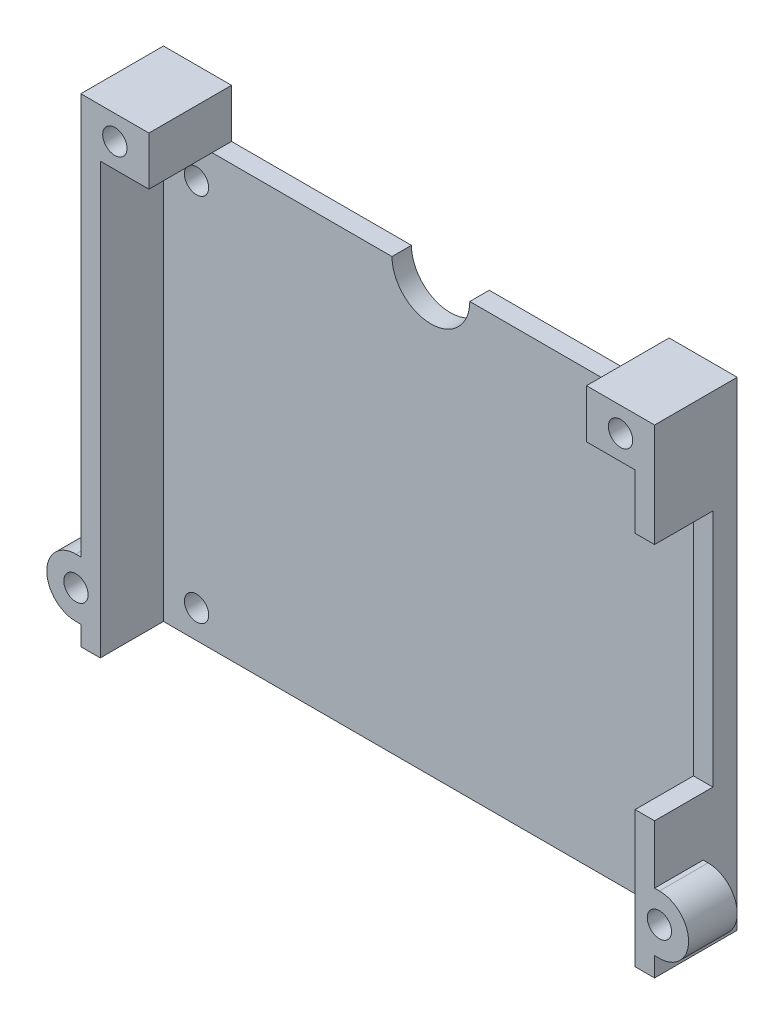
from build123d import *

# Parameters (mm, degrees)
BOSS_EXTRUDE1_DEPTH = 44.25
SKETCH2_W           = 6
SKETCH2_H           = 24.6
CUT_EXTRUDE1_DEPTH  = 10
BOSS_EXTRUDE2_DEPTH = 8.5
CUT_EXTRUDE2_DEPTH  = 11
SKETCH4_W           = 7
SKETCH4_H           = 8.5
BOSS_EXTRUDE3_DEPTH = 5
SKETCH5_R           = 1.25
CUT_EXTRUDE3_DEPTH  = 81.025386597
SKETCH7_R           = 1.25
CUT_EXTRUDE4_DEPTH  = 10
SKETCH8_R           = 4
CUT_EXTRUDE5_DEPTH  = 81.025386597
CUT_EXTRUDE6_DEPTH  = 3.5
BOSS_EXTRUDE4_DEPTH = 3


with BuildPart() as part:
    # Sketch1 → Boss-Extrude1 (new body)
    with BuildSketch(Plane(origin=(0, 0, 0), x_dir=(1, 0, 0), z_dir=(0, 1, 0))):
        Polygon((0, 0), (2, 0), (2, 6.5), (57, 6.5), (57, 0), (59, 0), (59, 8.5), (0, 8.5), align=None)
    extrude(amount=BOSS_EXTRUDE1_DEPTH)

    # Sketch2 → Cut-Extrude1 (cut)
    with BuildSketch(Plane(origin=(59, 0, 0), x_dir=(0, 0, -1), z_dir=(1, 0, 0))):
        with Locations((3, 26.3)):
            Rectangle(SKETCH2_W, SKETCH2_H)
    extrude(amount=-CUT_EXTRUDE1_DEPTH, mode=Mode.SUBTRACT)

    # Sketch3 → Boss-Extrude2 (add)
    with BuildSketch(Plane(origin=(0, 0, -8.5), x_dir=(-1, 0, 0), z_dir=(0, 0, -1))):
        with BuildLine():
            Line((-59, 6.145643924), (-59, 8))
            Line((-59, 8), (-59.5, 8))
            ThreePointArc((-59.5, 8), (-62.5, 5), (-59.5, 2))
            Line((-59.5, 2), (-59, 2))
            Line((-59, 2), (-59, 3.854356076))
            ThreePointArc((-59, 3.854356076), (-60.75, 5), (-59, 6.145643924))
        make_face()
        with BuildLine():
            Line((0.5, 8), (0, 8))
            Line((0, 8), (0, 6.145643924))
            ThreePointArc((0, 6.145643924), (1.75, 5), (0, 3.854356076))
            Line((0, 3.854356076), (0, 2))
            Line((0, 2), (0.5, 2))
            ThreePointArc((0.5, 2), (3.5, 5), (0.5, 8))
        make_face()
    extrude(amount=-BOSS_EXTRUDE2_DEPTH)

    # Sketch3<3> → Cut-Extrude2 (cut)
    with BuildSketch(Plane(origin=(0, 0, -8.5), x_dir=(-1, 0, 0), z_dir=(0, 0, -1))):
        with BuildLine():
            ThreePointArc((-59, 3.854356076), (-58.25, 5), (-59, 6.145643924))
            Line((-59, 6.145643924), (-59, 3.854356076))
        make_face()
        with BuildLine():
            Line((0, 3.854356076), (0, 6.145643924))
            ThreePointArc((0, 6.145643924), (-0.75, 5), (0, 3.854356076))
        make_face()
    extrude(amount=-CUT_EXTRUDE2_DEPTH, mode=Mode.SUBTRACT)

    # Sketch4 → Boss-Extrude3 (add)
    with BuildSketch(Plane(origin=(0, 44.25, 0), x_dir=(1, 0, 0), z_dir=(0, 1, 0))):
        with Locations((3.5, 4.25)):
            Rectangle(SKETCH4_W, SKETCH4_H)
        with Locations((55.5, 4.25)):
            Rectangle(SKETCH4_W, SKETCH4_H)
    extrude(amount=BOSS_EXTRUDE3_DEPTH)

    # Sketch5 → Cut-Extrude3 (cut, through all)
    with BuildSketch(Plane(origin=(0, 0, -8.5), x_dir=(-1, 0, 0), z_dir=(0, 0, -1))):
        with Locations((-55.5, 46.75)):
            Circle(SKETCH5_R)
        with Locations((-3.5, 46.75)):
            Circle(SKETCH5_R)
    extrude(amount=-CUT_EXTRUDE3_DEPTH, mode=Mode.SUBTRACT)

    # Sketch7 → Cut-Extrude4 (cut)
    with BuildSketch(Plane(origin=(0, 0, -8.5), x_dir=(-1, 0, 0), z_dir=(0, 0, -1))):
        with Locations((-5.4, 2.9)):
            Circle(SKETCH7_R)
        with Locations((-53.6, 2.9)):
            Circle(SKETCH7_R)
        with Locations((-53.6, 40.95)):
            Circle(SKETCH7_R)
        with Locations((-5.4, 40.95)):
            Circle(SKETCH7_R)
    extrude(amount=-CUT_EXTRUDE4_DEPTH, mode=Mode.SUBTRACT)

    # Sketch8 → Cut-Extrude5 (cut, through all)
    with BuildSketch(Plane(origin=(0, 0, -8.5), x_dir=(-1, 0, 0), z_dir=(0, 0, -1))):
        with Locations((-29.5, 44.25)):
            Circle(SKETCH8_R)
    extrude(amount=-CUT_EXTRUDE5_DEPTH, mode=Mode.SUBTRACT)

    # Sketch3<4> → Cut-Extrude6 (cut)
    with BuildSketch(Plane(origin=(0, 0, -8.5), x_dir=(-1, 0, 0), z_dir=(0, 0, -1))):
        with BuildLine():
            Line((-59, 6.145643924), (-59, 8))
            Line((-59, 8), (-59.5, 8))
            ThreePointArc((-59.5, 8), (-62.5, 5), (-59.5, 2))
            Line((-59.5, 2), (-59, 2))
            Line((-59, 2), (-59, 3.854356076))
            ThreePointArc((-59, 3.854356076), (-60.75, 5), (-59, 6.145643924))
        make_face()
        with BuildLine():
            Line((0.5, 8), (0, 8))
            Line((0, 8), (0, 6.145643924))
            ThreePointArc((0, 6.145643924), (1.75, 5), (0, 3.854356076))
            Line((0, 3.854356076), (0, 2))
            Line((0, 2), (0.5, 2))
            ThreePointArc((0.5, 2), (3.5, 5), (0.5, 8))
        make_face()
    extrude(amount=-CUT_EXTRUDE6_DEPTH, mode=Mode.SUBTRACT)

    # Sketch3<5> → Boss-Extrude4 (add)
    with BuildSketch(Plane(origin=(0, 0, -8.5), x_dir=(-1, 0, 0), z_dir=(0, 0, -1))):
        with BuildLine():
            ThreePointArc((-59, 3.854356076), (-58.25, 5), (-59, 6.145643924))
            Line((-59, 6.145643924), (-59, 3.854356076))
        make_face()
        with BuildLine():
            Line((0, 3.854356076), (0, 6.145643924))
            ThreePointArc((0, 6.145643924), (-0.75, 5), (0, 3.854356076))
        make_face()
    extrude(amount=-BOSS_EXTRUDE4_DEPTH)


solid = part.part
